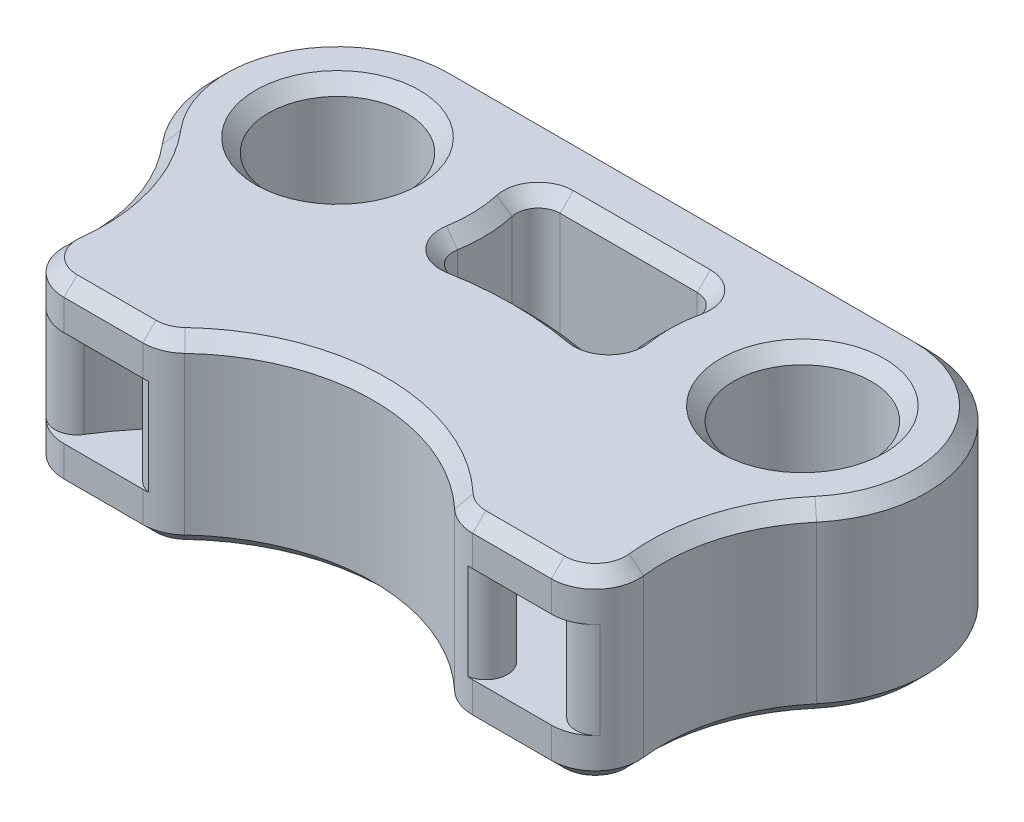
from build123d import *

# Parameters (mm, degrees)
SKETCH1_R           = 1.575
BOSS_EXTRUDE1_DEPTH = 4.2
CUT_EXTRUDE1_START  = 1
CUT_EXTRUDE1_DEPTH  = 2.2
FILLET1_R           = 1
FILLET2_R           = 0.5
FILLET7_R           = 0.5
FILLET8_R           = 1
SKETCH1_5_R         = 1.575
CUT_EXTRUDE2_DEPTH  = 12.345581829
FILLET9_R           = 0.5
CHAMFER1_SIZE       = 0.3


with BuildPart() as part:
    # Sketch1 → Boss-Extrude1 (new body)
    with BuildSketch(Plane(origin=(0, 0, 0), x_dir=(1, 0, 0), z_dir=(0, 1, 0))):
        with BuildLine():
            ThreePointArc((6.873863542, -6), (6.585147062, -3.833506375), (7.487493929, -1.842822581))
            ThreePointArc((7.487493929, -1.842822581), (7.902329882, 1.193983827), (5.32, 2.845))
            Line((5.32, 2.845), (-3.560738791, 2.845))
            ThreePointArc((-3.560738791, 2.845), (-8.244788973, 1.623155712), (-6.803439361, -2.998071491))
            ThreePointArc((-6.803439361, -2.998071491), (-6.543707564, -4.505955025), (-6.873863542, -6))
            Line((-6.873863542, -6), (-3.354101966, -6))
            ThreePointArc((-3.354101966, -6), (0, -4.5), (3.354101966, -6))
            Line((3.354101966, -6), (6.873863542, -6))
        make_face()
        with BuildLine():
            Line((-2.257321434, 1.345), (2.257321434, 1.345))
            ThreePointArc((2.257321434, 1.345), (1.975023179, 0.012452465), (2.247392302, -1.322159949))
            ThreePointArc((2.247392302, -1.322159949), (0, -1), (-2.247392302, -1.322159949))
            ThreePointArc((-2.247392302, -1.322159949), (-1.975023179, 0.012452465), (-2.257321434, 1.345))
        make_face(mode=Mode.SUBTRACT)
        with Locations(Location((5.32, 0, 0), (0, 0, 270))):
            Circle(SKETCH1_R, mode=Mode.SUBTRACT)
    extrude(amount=BOSS_EXTRUDE1_DEPTH)

    # Sketch1<4> → Cut-Extrude1 (cut)
    with BuildSketch(Plane(origin=(0, 0, 0), x_dir=(1, 0, 0), z_dir=(0, 1, 0)).offset(CUT_EXTRUDE1_START)):
        with BuildLine():
            ThreePointArc((5.766281297, -6), (0, -2.5), (-5.766281297, -6))
            Line((-5.766281297, -6), (-4.609772229, -6))
            ThreePointArc((-4.609772229, -6), (0, -3.5), (4.609772229, -6))
            Line((4.609772229, -6), (5.766281297, -6))
        make_face()
        with BuildLine():
            Line((-4.609772229, -6), (-5.766281297, -6))
            ThreePointArc((-5.766281297, -6), (-1.544210408, -15.313906415), (6.5, -9))
            ThreePointArc((6.5, -9), (6.313906415, -7.455789592), (5.766281297, -6))
            Line((5.766281297, -6), (4.609772229, -6))
            ThreePointArc((4.609772229, -6), (5.272748205, -7.435351039), (5.5, -9))
            ThreePointArc((5.5, -9), (-1.564648961, -14.272748205), (-4.609772229, -6))
        make_face()
    extrude(amount=CUT_EXTRUDE1_DEPTH, mode=Mode.SUBTRACT)

    # Fillet1
    # the kernel refuses this fillet: 1 mm, written as the material it takes off along each edge
    with BuildSketch(Plane(origin=(6.873863542, -3.241082043, 6), x_dir=(-1, 0, 0), z_dir=(0, 1, 0))) as fillet1_piece_1:
        with BuildLine():
            CenterArc((1.296432817, -1), FILLET1_R, 90, 96.787220168)
            ThreePointArc((0.303440924, -1.118182484), (0.19275538, -0.547955606), (0, 0))
            Line((0, 0), (1.296432817, 0))
        make_face()
    extrude(amount=10.682164085, mode=Mode.SUBTRACT)
    with BuildSketch(Plane(origin=(-6.873863542, -3.241082043, 6), x_dir=(1, 0, 0), z_dir=(0, 1, 0))) as fillet1_piece_2:
        with BuildLine():
            CenterArc((1.296432817, 1), FILLET1_R, 173.212779832, 96.787220168)
            ThreePointArc((0.303440924, 1.118182484), (0.19275538, 0.547955606), (0, 0))
            Line((0, 0), (1.296432817, 0))
        make_face()
    extrude(amount=10.682164085, mode=Mode.SUBTRACT)

    # Fillet2
    fillet2_edges = [part.edges().sort_by_distance(p)[0] for p in [
        (4.609772229, 2.1, 6),
        (-4.609772229, 2.1, 6),
    ]]
    fillet(fillet2_edges, radius=FILLET2_R)

    # Fillet7
    fillet7_edges = [part.edges().sort_by_distance(p)[0] for p in [
        (-5.757725838, 2.1, 5.983612562),
        (5.757725838, 2.1, 5.983612562),
    ]]
    fillet(fillet7_edges, radius=FILLET7_R)

    # Fillet8
    # the kernel refuses this fillet: 1 mm, written as the material it takes off along each edge
    with BuildSketch(Plane(origin=(3.354101966, -1.052038128, 6), x_dir=(-0.6975938840244129, 0, -0.7164933865512882), z_dir=(0, 1, 0))) as fillet8_piece_1:
        with BuildLine():
            CenterArc((0.422935241, -0.999105229), FILLET8_R, 92.423963438, 43.341758227)
            Line((-0.293558146, -0.301511345), (0, 0))
            ThreePointArc((0, 0), (0.190320858, -0.004026471), (0.380641717, 0))
        make_face()
    extrude(amount=6.304076257, mode=Mode.SUBTRACT)
    with BuildSketch(Plane(origin=(-3.354101966, -1.052038128, 6), x_dir=(-1, 0, 0), z_dir=(0, 1, 0))) as fillet8_piece_2:
        with BuildLine():
            CenterArc((0.420815251, -1), FILLET8_R, 90, 43.341758227)
            ThreePointArc((-0.265533334, -0.272727273), (-0.129881727, -0.139172478), (0, 0))
            Line((0, 0), (0.420815251, 0))
        make_face()
    extrude(amount=6.304076257, mode=Mode.SUBTRACT)

    # Sketch1<5> → Cut-Extrude2 (cut, through all)
    with BuildSketch(Plane(origin=(0, 0, 0), x_dir=(1, 0, 0), z_dir=(0, 1, 0))):
        with BuildLine():
            ThreePointArc((-3.560738791, 2.845), (-8.244788973, 1.623155712), (-6.803439361, -2.998071491))
            ThreePointArc((-6.803439361, -2.998071491), (-7.096248647, -2.391303709), (-7.487493929, -1.842822581))
            ThreePointArc((-7.487493929, -1.842822581), (-7.902329882, 1.193983827), (-5.32, 2.845))
            Line((-5.32, 2.845), (-3.560738791, 2.845))
        make_face()
        with Locations(Location((-5.32, 0, 0), (0, 0, 270))):
            Circle(SKETCH1_5_R)
    extrude(amount=CUT_EXTRUDE2_DEPTH, mode=Mode.SUBTRACT)

    # Fillet9
    fillet9_edges = [part.edges().sort_by_distance(p)[0] for p in [
        (2.257321434, 2.1, -1.345),
        (-2.257321434, 2.1, -1.345),
        (-2.247392302, 2.1, 1.322159949),
        (2.247392302, 2.1, 1.322159949),
    ]]
    fillet(fillet9_edges, radius=FILLET9_R)

    # Chamfer1
    chamfer1_edges = [part.edges().sort_by_distance(p)[0] for p in [
        (6.325154767, 0, 5.664009607),
        (-6.711804448, 4.2, 3.266613185),
        (-4.676173972, 4.2, 6),
        (-6.325154767, 4.2, 5.664009607),
        (6.325154767, 4.2, 5.664009607),
        (7.902329882, 4.2, -1.193983827),
        (5.32, 0, -1.575),
        (4.676173972, 4.2, 6),
        (4.676173972, 0, 6),
        (0, 0, 4.5),
        (-3.405642745, 0, 5.929320377),
        (3.405642745, 0, 5.929320377),
        (0, 4.2, 4.5),
        (-3.405642745, 4.2, 5.929320377),
        (3.405642745, 4.2, 5.929320377),
        (7.902329882, 0, -1.193983827),
        (-7.902329882, 4.2, -1.193983827),
        (-7.902329882, 0, -1.193983827),
        (-5.32, 0, -1.575),
        (-5.32, 4.2, -1.575),
        (0, 0, 1),
        (0, 4.2, 1),
        (1.976252426, 0, -0.091526844),
        (1.976252426, 4.2, -0.091526844),
        (0, 0, -1.345),
        (0, 4.2, -1.345),
        (-1.976252426, 0, -0.091526844),
        (-1.976252426, 4.2, -0.091526844),
        (1.87947049, 0, 0.994550688),
        (1.87947049, 4.2, 0.994550688),
        (1.959475153, 0, -1.157296748),
        (1.959475153, 4.2, -1.157296748),
        (-1.959475153, 0, -1.157296748),
        (-1.959475153, 4.2, -1.157296748),
        (-1.87947049, 0, 0.994550688),
        (-1.87947049, 4.2, 0.994550688),
        (0, 0, -2.845),
        (0, 4.2, -2.845),
        (5.32, 4.2, -1.575),
        (6.711804448, 0, 3.266613185),
        (6.711804448, 4.2, 3.266613185),
        (-4.676173972, 0, 6),
        (-6.711804448, 0, 3.266613185),
        (-6.325154767, 0, 5.664009607),
    ]]
    chamfer(chamfer1_edges, length=CHAMFER1_SIZE)


solid = part.part
